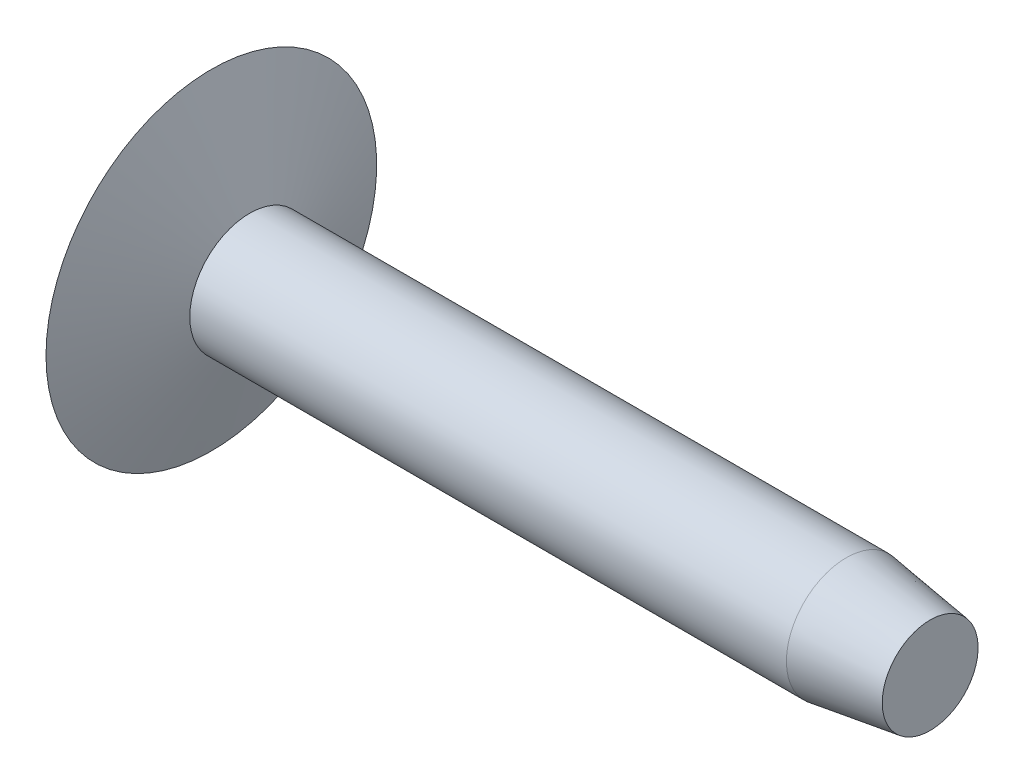
from build123d import *


with BuildPart() as part:
    # Sketch1 → Base-Revolve (revolve)
    with BuildSketch(Plane.XY):
        Polygon((0, 0), (0, 6.9), (1.601469031, 2.5), (26.5, 2.5), (30, 2), (30, 0), align=None)
    revolve(axis=Axis((0, 0, 0), (1, 0, 0)))


solid = part.part
